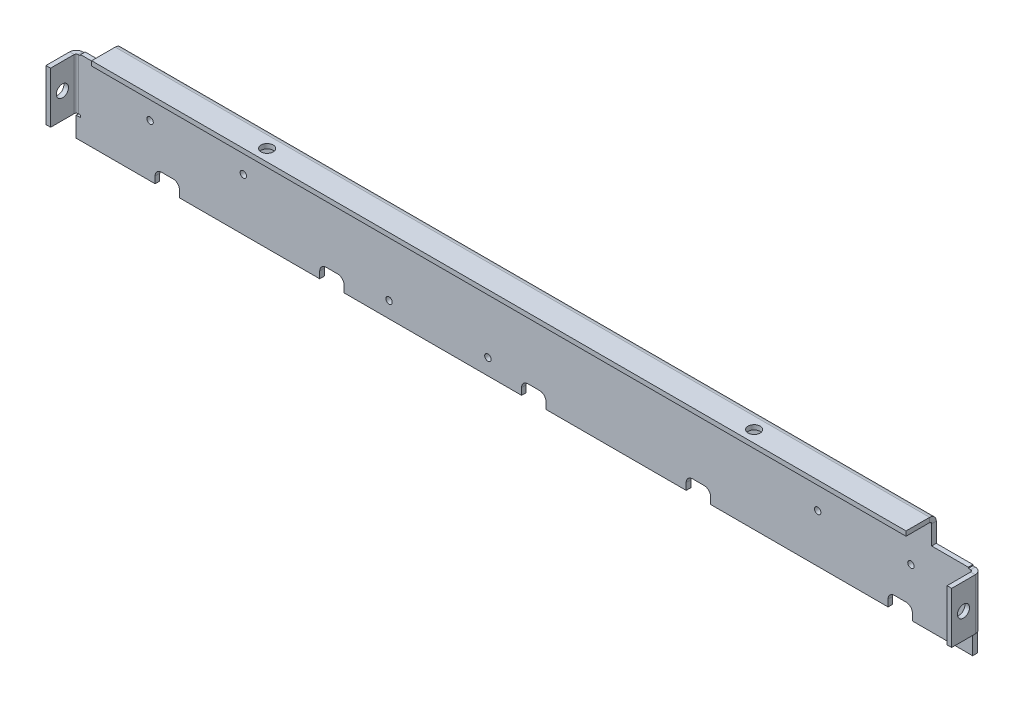
from build123d import *

# Parameters (mm, degrees)
SKETCH1_W                     = 444.26599996
SKETCH1_H                     = 47.498
BASE_FLANGE1_DEPTH            = 2.286
EDGE_FLANGE1_STRIP_W          = 11.144
EDGE_FLANGE1_STRIP_H          = 2.286
EDGE_FLANGE1_STRIP_CUT_DEPTH  = 25.4
EDGE_FLANGE1_RELIEF_W         = 12.287
EDGE_FLANGE1_RELIEF_H         = 1.143
EDGE_FLANGE1_RELIEF_CUT_DEPTH = 2.286
EDGE_FLANGE1_DEPTH            = 25.4
EDGE_FLANGE2_STRIP_W          = 11.144
EDGE_FLANGE2_STRIP_H          = 2.286
EDGE_FLANGE2_STRIP_CUT_DEPTH  = 25.4
EDGE_FLANGE2_RELIEF_W         = 12.287
EDGE_FLANGE2_RELIEF_H         = 1.143
EDGE_FLANGE2_RELIEF_CUT_DEPTH = 2.286
EDGE_FLANGE2_DEPTH            = 25.4
EDGE_FLANGE6_STRIP_W          = 11.144
EDGE_FLANGE6_STRIP_H          = 2.286
EDGE_FLANGE6_STRIP_CUT_DEPTH  = 444.26599996
EDGE_FLANGE6_DEPTH            = 444.26599996
SKETCH52_R                    = 3
CUT_EXTRUDE2_DEPTH            = 231.225159807
SKETCH53_R                    = 3
CUT_EXTRUDE3_DEPTH            = 450.771788169
SKETCH54_W                    = 20.32
SKETCH54_H                    = 5.08
SKETCH54_H_2                  = 7.739
SKETCH54_H_3                  = 4.453
CUT_EXTRUDE4_DEPTH            = 227.280796306
CUT_EXTRUDE5_DEPTH            = 227.280796306
FILLET1_R                     = 3.175
SKETCH57_R                    = 1.5875
CUT_EXTRUDE6_DEPTH            = 227.280796306


# Sheet-metal steps are written as plain solids
with BuildPart() as part:
    # Sketch1 → Base-Flange1 (new body)
    with BuildSketch(Plane.XY):
        Rectangle(SKETCH1_W, SKETCH1_H)
    extrude(amount=-BASE_FLANGE1_DEPTH)

    # Edge-Flange1 strip (across the edge) → Edge-Flange1 strip cut (cut)
    with BuildSketch(Plane(origin=(222.13299998, -12.7, 0), x_dir=(-1, 0, 0), z_dir=(0, 1, 0))):
        with Locations((-4.572, -1.143)):
            Rectangle(EDGE_FLANGE1_STRIP_W, EDGE_FLANGE1_STRIP_H)
    extrude(amount=EDGE_FLANGE1_STRIP_CUT_DEPTH, mode=Mode.SUBTRACT)

    # Edge-Flange1 relief (on the sheet) → Edge-Flange1 relief cut (cut)
    with BuildSketch(Plane(origin=(221.13299998, -12.7, 0), x_dir=(-1, 0, 0), z_dir=(0, 0, 1))):
        with Locations((-5.0005, 0.5715)):
            Rectangle(EDGE_FLANGE1_RELIEF_W, EDGE_FLANGE1_RELIEF_H)
        with Locations((-5.0005, -25.9715)):
            Rectangle(EDGE_FLANGE1_RELIEF_W, EDGE_FLANGE1_RELIEF_H)
    extrude(amount=-EDGE_FLANGE1_RELIEF_CUT_DEPTH, mode=Mode.SUBTRACT)

    # Edge-Flange1 section (across the edge) → Edge-Flange1 (add)
    with BuildSketch(Plane(origin=(222.13299998, -12.7, 0), x_dir=(-1, 0, 0), z_dir=(0, 1, 0))):
        with BuildLine():
            Line((-2.286, 1), (-2.286, 12.7))
            Line((-2.286, 12.7), (0, 12.7))
            Line((0, 12.7), (0, 1))
            ThreePointArc((0, 1), (0.292893219, 0.292893219), (1, 0))
            Line((1, 0), (1, -2.286))
            ThreePointArc((1, -2.286), (-1.323552883, -1.323552883), (-2.286, 1))
        make_face()
    extrude(amount=EDGE_FLANGE1_DEPTH)

    # Edge-Flange2 strip (across the edge) → Edge-Flange2 strip cut (cut)
    with BuildSketch(Plane(origin=(-222.13299998, 12.7, 0), x_dir=(1, 0, 0), z_dir=(0, -1, 0))):
        with Locations((-4.572, -1.143)):
            Rectangle(EDGE_FLANGE2_STRIP_W, EDGE_FLANGE2_STRIP_H)
    extrude(amount=EDGE_FLANGE2_STRIP_CUT_DEPTH, mode=Mode.SUBTRACT)

    # Edge-Flange2 relief (on the sheet) → Edge-Flange2 relief cut (cut)
    with BuildSketch(Plane(origin=(-221.13299998, 12.7, 0), x_dir=(1, 0, 0), z_dir=(0, 0, 1))):
        with Locations((-5.0005, 0.5715)):
            Rectangle(EDGE_FLANGE2_RELIEF_W, EDGE_FLANGE2_RELIEF_H)
        with Locations((-5.0005, -25.9715)):
            Rectangle(EDGE_FLANGE2_RELIEF_W, EDGE_FLANGE2_RELIEF_H)
    extrude(amount=-EDGE_FLANGE2_RELIEF_CUT_DEPTH, mode=Mode.SUBTRACT)

    # Edge-Flange2 section (across the edge) → Edge-Flange2 (add)
    with BuildSketch(Plane(origin=(-222.13299998, 12.7, 0), x_dir=(1, 0, 0), z_dir=(0, -1, 0))):
        with BuildLine():
            Line((-2.286, 1), (-2.286, 12.7))
            Line((-2.286, 12.7), (0, 12.7))
            Line((0, 12.7), (0, 1))
            ThreePointArc((0, 1), (0.292893219, 0.292893219), (1, 0))
            Line((1, 0), (1, -2.286))
            ThreePointArc((1, -2.286), (-1.323552883, -1.323552883), (-2.286, 1))
        make_face()
    extrude(amount=EDGE_FLANGE2_DEPTH)

    # Edge-Flange6 strip (across the edge) → Edge-Flange6 strip cut (cut)
    with BuildSketch(Plane(origin=(222.13299998, 23.749, 0), x_dir=(0, -1, 0), z_dir=(-1, 0, 0))):
        with Locations((-4.572, -1.143)):
            Rectangle(EDGE_FLANGE6_STRIP_W, EDGE_FLANGE6_STRIP_H)
    extrude(amount=EDGE_FLANGE6_STRIP_CUT_DEPTH, mode=Mode.SUBTRACT)

    # Edge-Flange6 section (across the edge) → Edge-Flange6 (add)
    with BuildSketch(Plane(origin=(222.13299998, 23.749, 0), x_dir=(0, -1, 0), z_dir=(-1, 0, 0))):
        with BuildLine():
            Line((-2.286, 1), (-2.286, 12.7))
            Line((-2.286, 12.7), (0, 12.7))
            Line((0, 12.7), (0, 1))
            ThreePointArc((0, 1), (0.292893219, 0.292893219), (1, 0))
            Line((1, 0), (1, -2.286))
            ThreePointArc((1, -2.286), (-1.323552883, -1.323552883), (-2.286, 1))
        make_face()
    extrude(amount=EDGE_FLANGE6_DEPTH)

    # Sketch52 → Cut-Extrude2 (cut, through all)
    with BuildSketch(Plane(origin=(0, 26.035, 0), x_dir=(1, 0, 0), z_dir=(0, 1, 0))):
        with Locations(Location((120.65, -6.85, 0), (0, 0, 270))):
            Circle(SKETCH52_R)
        with Locations(Location((-120.65, -6.85, 0), (0, 0, 270))):
            Circle(SKETCH52_R)
    extrude(amount=-CUT_EXTRUDE2_DEPTH, mode=Mode.SUBTRACT)

    # Sketch53 → Cut-Extrude3 (cut, through all)
    with BuildSketch(Plane(origin=(224.41899998, 0, 0), x_dir=(0, 0, -1), z_dir=(1, 0, 0))):
        with Locations((-6.85, 0)):
            Circle(SKETCH53_R)
    extrude(amount=-CUT_EXTRUDE3_DEPTH, mode=Mode.SUBTRACT)

    # Sketch54 → Cut-Extrude4 (cut, symmetric)
    with BuildSketch(Plane.XY):
        with Locations((211.97299998, 15.756)):
            Rectangle(SKETCH54_W, SKETCH54_H)
        with Locations((211.97299998, 22.1655)):
            Rectangle(SKETCH54_W, SKETCH54_H_2)
        with Locations((211.97299998, 20.5225)):
            Rectangle(SKETCH54_W, SKETCH54_H_3)
    cut_extrude4 = extrude(amount=CUT_EXTRUDE4_DEPTH, both=True, mode=Mode.SUBTRACT)

    # Mirror1: Cut-Extrude4 across plane
    add(cut_extrude4.mirror(Plane(origin=(0, 0, 0), x_dir=(0, 0, 1), z_dir=(1, 0, 0))), mode=Mode.SUBTRACT)

    # Sketch55 → Cut-Extrude5 (cut, through all)
    # profile 1 of 15: a face of its own
    with BuildSketch(Plane.XY):
        Polygon((-179.589939095, -42.289), (-174.395060873, -42.289), (-172.452499984, -40.346439111), (-172.452499984, -26.101102448), (-170.952499984, -24.601102448), (-170.952499984, -18.896897552), (-172.640397536, -17.209), (-181.344602432, -17.209), (-183.032499984, -18.896897552), (-183.032499984, -24.601102448), (-181.532499984, -26.101102448), (-181.532499984, -40.346439111), align=None)
        with BuildLine():
            Line((-174.992499984, -39.294336663), (-175.447163321, -39.749))
            Line((-175.447163321, -39.749), (-178.537836647, -39.749))
            Line((-178.537836647, -39.749), (-178.992499984, -39.294336663))
            Line((-178.992499984, -39.294336663), (-178.992499984, -23.949))
            ThreePointArc((-178.992499984, -23.949), (-179.051078628, -23.807578644), (-179.192499984, -23.749))
            Line((-179.192499984, -23.749), (-180.292499984, -23.749))
            Line((-180.292499984, -23.749), (-180.492499984, -23.549))
            Line((-180.492499984, -23.549), (-180.492499984, -19.949))
            Line((-180.492499984, -19.949), (-180.292499984, -19.749))
            Line((-180.292499984, -19.749), (-173.692499984, -19.749))
            Line((-173.692499984, -19.749), (-173.492499984, -19.949))
            Line((-173.492499984, -19.949), (-173.492499984, -23.549))
            Line((-173.492499984, -23.549), (-173.692499984, -23.749))
            Line((-173.692499984, -23.749), (-174.792499984, -23.749))
            ThreePointArc((-174.792499984, -23.749), (-174.93392134, -23.807578644), (-174.992499984, -23.949))
            Line((-174.992499984, -23.949), (-174.992499984, -39.294336663))
        make_face(mode=Mode.SUBTRACT)
    # profile 2 of 15: a face of its own
    with BuildSketch(Plane.XY):
        Polygon((-172.640397536, -17.209), (-170.952499984, -18.896897552), (-170.952499984, -17.209), align=None)
    # profile 3 of 15: a face of its own
    with BuildSketch(Plane.XY):
        Polygon((-183.032499984, -17.209), (-183.032499984, -18.896897552), (-181.344602432, -17.209), align=None)
    # profile 4 of 15: a face of its own
    with BuildSketch(Plane.XY):
        Polygon((-90.883499992, -40.346439111), (-90.883499992, -26.101102448), (-89.383499992, -24.601102448), (-89.383499992, -18.896897552), (-91.071397544, -17.209), (-99.77560244, -17.209), (-101.463499992, -18.896897552), (-101.463499992, -24.601102448), (-99.963499992, -26.101102448), (-99.963499992, -40.346439111), (-98.020939103, -42.289), (-92.826060881, -42.289), align=None)
        with BuildLine():
            ThreePointArc((-93.223499992, -23.749), (-93.364921348, -23.807578644), (-93.423499992, -23.949))
            Line((-93.423499992, -23.949), (-93.423499992, -39.294336663))
            Line((-93.423499992, -39.294336663), (-93.878163329, -39.749))
            Line((-93.878163329, -39.749), (-96.968836655, -39.749))
            Line((-96.968836655, -39.749), (-97.423499992, -39.294336663))
            Line((-97.423499992, -39.294336663), (-97.423499992, -23.949))
            ThreePointArc((-97.423499992, -23.949), (-97.482078636, -23.807578644), (-97.623499992, -23.749))
            Line((-97.623499992, -23.749), (-98.723499992, -23.749))
            Line((-98.723499992, -23.749), (-98.923499992, -23.549))
            Line((-98.923499992, -23.549), (-98.923499992, -19.949))
            Line((-98.923499992, -19.949), (-98.723499992, -19.749))
            Line((-98.723499992, -19.749), (-92.123499992, -19.749))
            Line((-92.123499992, -19.749), (-91.923499992, -19.949))
            Line((-91.923499992, -19.949), (-91.923499992, -23.549))
            Line((-91.923499992, -23.549), (-92.123499992, -23.749))
            Line((-92.123499992, -23.749), (-93.223499992, -23.749))
        make_face(mode=Mode.SUBTRACT)
    # profile 5 of 15: a face of its own
    with BuildSketch(Plane.XY):
        Polygon((-91.071397544, -17.209), (-89.383499992, -18.896897552), (-89.383499992, -17.209), align=None)
    # profile 6 of 15: a face of its own
    with BuildSketch(Plane.XY):
        Polygon((-101.463499992, -18.896897552), (-99.77560244, -17.209), (-101.463499992, -17.209), align=None)
    # profile 7 of 15: a face of its own
    with BuildSketch(Plane.XY):
        Polygon((2.024060897, -42.289), (7.218939119, -42.289), (9.161500008, -40.346439111), (9.161500008, -26.101102448), (10.661500008, -24.601102448), (10.661500008, -18.896897552), (8.973602456, -17.209), (0.26939756, -17.209), (-1.418499992, -18.896897552), (-1.418499992, -24.601102448), (0.081500008, -26.101102448), (0.081500008, -40.346439111), align=None)
        with BuildLine():
            Line((6.621500008, -39.294336663), (6.166836671, -39.749))
            Line((6.166836671, -39.749), (3.076163345, -39.749))
            Line((3.076163345, -39.749), (2.621500008, -39.294336663))
            Line((2.621500008, -39.294336663), (2.621500008, -23.949))
            ThreePointArc((2.621500008, -23.949), (2.562921364, -23.807578644), (2.421500008, -23.749))
            Line((2.421500008, -23.749), (1.321500008, -23.749))
            Line((1.321500008, -23.749), (1.121500008, -23.549))
            Line((1.121500008, -23.549), (1.121500008, -19.949))
            Line((1.121500008, -19.949), (1.321500008, -19.749))
            Line((1.321500008, -19.749), (7.921500008, -19.749))
            Line((7.921500008, -19.749), (8.121500008, -19.949))
            Line((8.121500008, -19.949), (8.121500008, -23.549))
            Line((8.121500008, -23.549), (7.921500008, -23.749))
            Line((7.921500008, -23.749), (6.821500008, -23.749))
            ThreePointArc((6.821500008, -23.749), (6.680078652, -23.807578644), (6.621500008, -23.949))
            Line((6.621500008, -23.949), (6.621500008, -39.294336663))
        make_face(mode=Mode.SUBTRACT)
    # profile 8 of 15: a face of its own
    with BuildSketch(Plane.XY):
        Polygon((8.973602456, -17.209), (10.661500008, -18.896897552), (10.661500008, -17.209), align=None)
    # profile 9 of 15: a face of its own
    with BuildSketch(Plane.XY):
        Polygon((-1.418499992, -17.209), (-1.418499992, -18.896897552), (0.26939756, -17.209), align=None)
    # profile 10 of 15: a face of its own
    with BuildSketch(Plane.XY):
        Polygon((90.7305, -40.346439111), (90.7305, -26.101102448), (92.2305, -24.601102448), (92.2305, -18.896897552), (90.542602448, -17.209), (81.838397552, -17.209), (80.1505, -18.896897552), (80.1505, -24.601102448), (81.6505, -26.101102448), (81.6505, -40.346439111), (83.593060889, -42.289), (88.787939111, -42.289), align=None)
        with BuildLine():
            ThreePointArc((88.3905, -23.749), (88.249078644, -23.807578644), (88.1905, -23.949))
            Line((88.1905, -23.949), (88.1905, -39.294336663))
            Line((88.1905, -39.294336663), (87.735836663, -39.749))
            Line((87.735836663, -39.749), (84.645163337, -39.749))
            Line((84.645163337, -39.749), (84.1905, -39.294336663))
            Line((84.1905, -39.294336663), (84.1905, -23.949))
            ThreePointArc((84.1905, -23.949), (84.131921356, -23.807578644), (83.9905, -23.749))
            Line((83.9905, -23.749), (82.8905, -23.749))
            Line((82.8905, -23.749), (82.6905, -23.549))
            Line((82.6905, -23.549), (82.6905, -19.949))
            Line((82.6905, -19.949), (82.8905, -19.749))
            Line((82.8905, -19.749), (89.4905, -19.749))
            Line((89.4905, -19.749), (89.6905, -19.949))
            Line((89.6905, -19.949), (89.6905, -23.549))
            Line((89.6905, -23.549), (89.4905, -23.749))
            Line((89.4905, -23.749), (88.3905, -23.749))
        make_face(mode=Mode.SUBTRACT)
    # profile 11 of 15: a face of its own
    with BuildSketch(Plane.XY):
        Polygon((90.542602448, -17.209), (92.2305, -18.896897552), (92.2305, -17.209), align=None)
    # profile 12 of 15: a face of its own
    with BuildSketch(Plane.XY):
        Polygon((80.1505, -18.896897552), (81.838397552, -17.209), (80.1505, -17.209), align=None)
    # profile 13 of 15: a face of its own
    with BuildSketch(Plane.XY):
        Polygon((183.638060889, -42.289), (188.832939111, -42.289), (190.7755, -40.346439111), (190.7755, -26.101102448), (192.2755, -24.601102448), (192.2755, -18.896897552), (190.587602448, -17.209), (181.883397552, -17.209), (180.1955, -18.896897552), (180.1955, -24.601102448), (181.6955, -26.101102448), (181.6955, -40.346439111), align=None)
        with BuildLine():
            Line((188.2355, -39.294336663), (187.780836663, -39.749))
            Line((187.780836663, -39.749), (184.690163337, -39.749))
            Line((184.690163337, -39.749), (184.2355, -39.294336663))
            Line((184.2355, -39.294336663), (184.2355, -23.949))
            ThreePointArc((184.2355, -23.949), (184.176921356, -23.807578644), (184.0355, -23.749))
            Line((184.0355, -23.749), (182.9355, -23.749))
            Line((182.9355, -23.749), (182.7355, -23.549))
            Line((182.7355, -23.549), (182.7355, -19.949))
            Line((182.7355, -19.949), (182.9355, -19.749))
            Line((182.9355, -19.749), (189.5355, -19.749))
            Line((189.5355, -19.749), (189.7355, -19.949))
            Line((189.7355, -19.949), (189.7355, -23.549))
            Line((189.7355, -23.549), (189.5355, -23.749))
            Line((189.5355, -23.749), (188.4355, -23.749))
            ThreePointArc((188.4355, -23.749), (188.294078644, -23.807578644), (188.2355, -23.949))
            Line((188.2355, -23.949), (188.2355, -39.294336663))
        make_face(mode=Mode.SUBTRACT)
    # profile 14 of 15: a face of its own
    with BuildSketch(Plane.XY):
        Polygon((190.587602448, -17.209), (192.2755, -18.896897552), (192.2755, -17.209), align=None)
    # profile 15 of 15: a face of its own
    with BuildSketch(Plane.XY):
        Polygon((180.1955, -17.209), (180.1955, -18.896897552), (181.883397552, -17.209), align=None)
    extrude(amount=-CUT_EXTRUDE5_DEPTH, mode=Mode.SUBTRACT)


with BuildPart() as cut_extrude5_kept_piece:
    # of the separate pieces the step leaves, the one the design keeps (cut_extrude5_pieces_kept)
    add(part.part.solids().sort_by_distance((-222.13299998, -23.749, 0))[0])

    # Fillet1
    fillet1_edges = [cut_extrude5_kept_piece.edges().sort_by_distance(p)[0] for p in [
        (-170.952499984, -17.209, -1.143),
        (-183.032499984, -17.209, -1.143),
        (-89.383499992, -17.209, -1.143),
        (-101.463499992, -17.209, -1.143),
        (10.661500008, -17.209, -1.143),
        (-1.418499992, -17.209, -1.143),
        (92.2305, -17.209, -1.143),
        (80.1505, -17.209, -1.143),
        (192.2755, -17.209, -1.143),
        (180.1955, -17.209, -1.143),
    ]]
    fillet(fillet1_edges, radius=FILLET1_R)

    # Sketch57 → Cut-Extrude6 (cut, through all)
    with BuildSketch(Plane.XY):
        with Locations((191.5365, 0.141)):
            Circle(SKETCH57_R)
        with Locations((145.3365, 0.141)):
            Circle(SKETCH57_R)
        with Locations((-18.1115, -15.859)):
            Circle(SKETCH57_R)
        with Locations((-67.1115, -15.859)):
            Circle(SKETCH57_R)
        with Locations((-139.3365, 2.141)):
            Circle(SKETCH57_R)
        with Locations((-185.5365, 2.141)):
            Circle(SKETCH57_R)
    extrude(amount=-CUT_EXTRUDE6_DEPTH, mode=Mode.SUBTRACT)


solid = cut_extrude5_kept_piece.part
